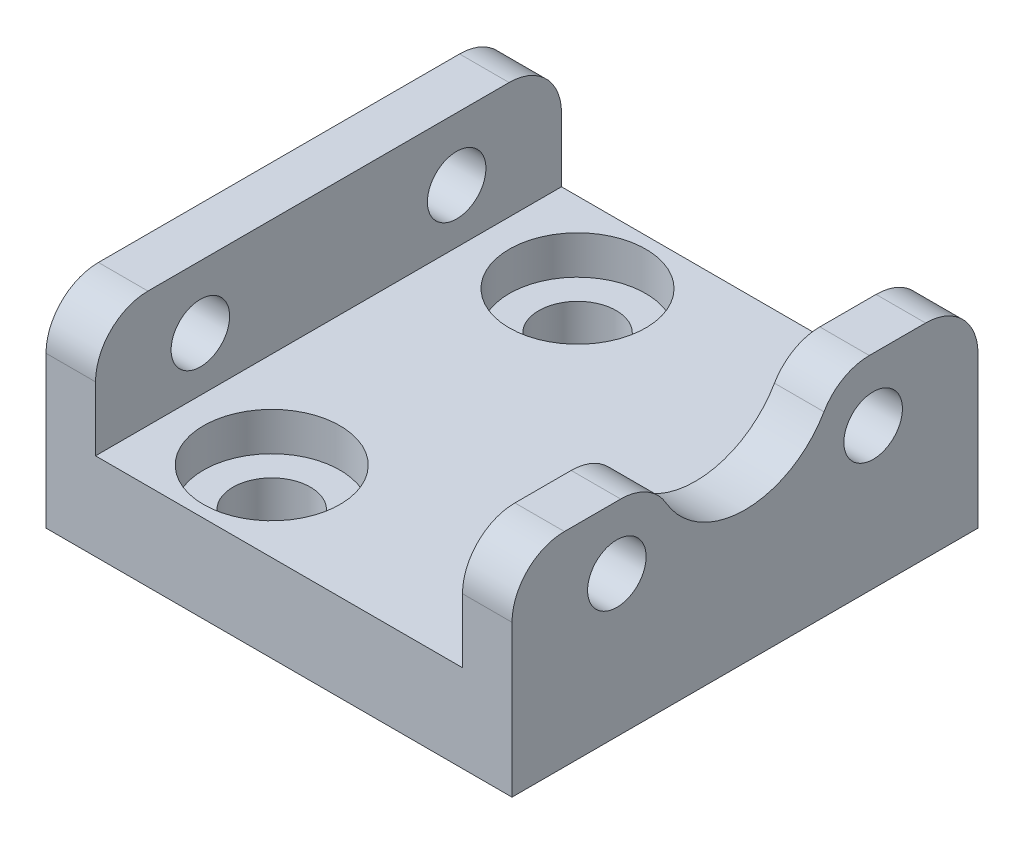
from build123d import *

# Parameters (mm, degrees)
SKETCH1_W                                        = 40.64
SKETCH1_H                                        = 40.64
BOSS_EXTRUDE1_DEPTH                              = 7.62
SKETCH2_W                                        = 4.318
SKETCH2_H                                        = 40.64
BOSS_EXTRUDE2_DEPTH                              = 10.16
F_10_CLEARANCE_HOLE1_D                           = 5.1054
CBORE_FOR_1_4_BUTTON_HEAD_CAP_SCREW1_D           = 6.7564
CBORE_FOR_1_4_BUTTON_HEAD_CAP_SCREW1_CBORE_D     = 11.90752
CBORE_FOR_1_4_BUTTON_HEAD_CAP_SCREW1_CBORE_DEPTH = 3.3528
CUT_EXTRUDE1_REACH                               = 62.161
SKETCH8_R                                        = 7.965368028
FILLET1_R                                        = 4.572


with BuildPart() as part:
    # Sketch1 → Boss-Extrude1 (new body)
    with BuildSketch(Plane(origin=(0, 0, 0), x_dir=(1, 0, 0), z_dir=(0, 1, 0))):
        with Locations((20.32, -20.32)):
            Rectangle(SKETCH1_W, SKETCH1_H)
    extrude(amount=BOSS_EXTRUDE1_DEPTH)

    # Sketch2 → Boss-Extrude2 (add)
    with BuildSketch(Plane(origin=(0, 7.62, 0), x_dir=(1, 0, 0), z_dir=(0, 1, 0))):
        with Locations((2.159, -20.32)):
            Rectangle(SKETCH2_W, SKETCH2_H)
        with Locations((38.481, -20.32)):
            Rectangle(SKETCH2_W, SKETCH2_H)
    extrude(amount=BOSS_EXTRUDE2_DEPTH)

    # #10 Clearance Hole1 (through all)
    with Locations(Plane.ZY):
        with Locations((9.144, 12.319), (31.496, 12.319)):
            Hole(F_10_CLEARANCE_HOLE1_D / 2)

    # CBORE for 1/4 Button Head Cap Screw1 (through all)
    with Locations(Plane(origin=(0, 7.62, 0), x_dir=(1, 0, 0), z_dir=(0, 1, 0))):
        with Locations((12.7, -6.985), (12.7, -33.655)):
            CounterBoreHole(CBORE_FOR_1_4_BUTTON_HEAD_CAP_SCREW1_D / 2, CBORE_FOR_1_4_BUTTON_HEAD_CAP_SCREW1_CBORE_D / 2, CBORE_FOR_1_4_BUTTON_HEAD_CAP_SCREW1_CBORE_DEPTH)

    # Sketch8 → Cut-Extrude1 (cut, up to next)
    with BuildSketch(Plane(origin=(40.64, 0, 0), x_dir=(0, 0, -1), z_dir=(1, 0, 0)), mode=Mode.PRIVATE) as cut_extrude1_sk1:
        with Locations((-20.32, 19.504553012)):
            Circle(SKETCH8_R)
    cut_extrude1_tool1 = extrude(cut_extrude1_sk1.sketch, amount=-CUT_EXTRUDE1_REACH, mode=Mode.PRIVATE) & part.part
    add(cut_extrude1_tool1.solids().sort_by_distance((40.64, 19.504553, 20.32))[0], mode=Mode.SUBTRACT)

    # Fillet1
    fillet1_edges = [part.edges().sort_by_distance(p)[0] for p in [
        (38.481, 17.78, 28.096439078),
        (38.481, 17.78, 12.543560922),
        (38.481, 17.78, 0),
        (38.481, 17.78, 40.64),
        (2.159, 17.78, 0),
        (2.159, 17.78, 40.64),
    ]]
    fillet(fillet1_edges, radius=FILLET1_R)


solid = part.part
